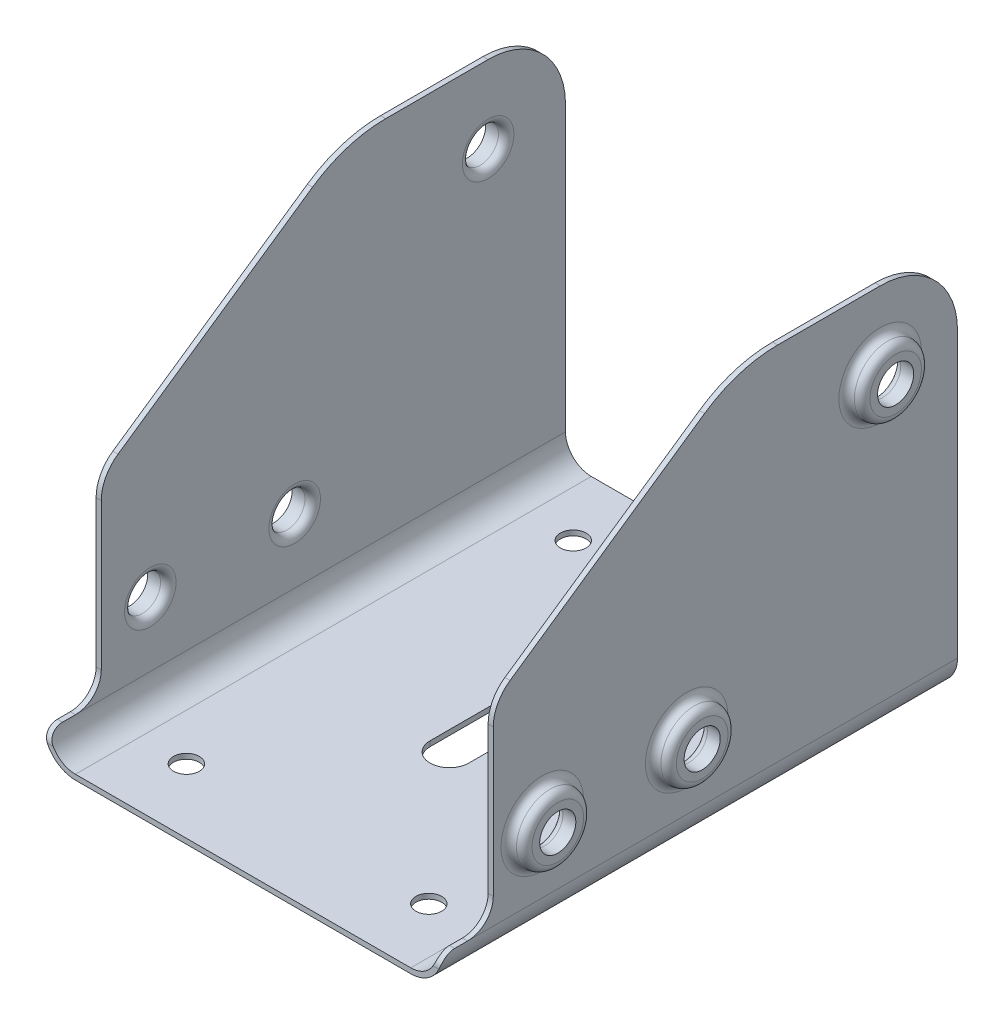
from build123d import *

# Parameters (mm, degrees)
SKETCH1_W                      = 150
SKETCH1_H                      = 200
BASE_FLANGE1_DEPTH             = 2
EDGE_FLANGE1_STRIP_W           = 28
EDGE_FLANGE1_STRIP_H           = 2
EDGE_FLANGE1_STRIP_CUT_DEPTH   = 200
EDGE_FLANGE1_STRIP_2_W         = 28
EDGE_FLANGE1_STRIP_2_H         = 2
EDGE_FLANGE1_STRIP_CUT_2_DEPTH = 200
EDGE_FLANGE1_DEPTH             = 200
EDGE_FLANGE1_BEND_DEPTH        = 200
SKETCH15_OUTSIDE_W             = 260.93
SKETCH15_OUTSIDE_H             = 212.93
SKETCH15_OUTSIDE_R             = 7
CUT_EXTRUDE1_DEPTH             = 238.099135384
SKETCH16_R                     = 5
CUT_EXTRUDE2_DEPTH             = 197.033160551
BOSS_EXTRUDE1_START            = 6
SKETCH17_R                     = 13
SKETCH17_R_2                   = 7
BOSS_EXTRUDE1_DEPTH            = 6
FILLET1_R                      = 3


# Sheet-metal steps are written as plain solids
with BuildPart() as part:
    # Sketch1 → Base-Flange1 (new body)
    with BuildSketch(Plane(origin=(0, 0, 0), x_dir=(1, 0, 0), z_dir=(0, 1, 0))):
        Rectangle(SKETCH1_W, SKETCH1_H)
    extrude(amount=-BASE_FLANGE1_DEPTH)

    # Edge-Flange1 strip (across the edge) → Edge-Flange1 strip cut (cut)
    with BuildSketch(Plane(origin=(75, 0, 100), x_dir=(-1, 0, 0), z_dir=(0, 0, -1))):
        with Locations((-4, -1)):
            Rectangle(EDGE_FLANGE1_STRIP_W, EDGE_FLANGE1_STRIP_H)
    extrude(amount=EDGE_FLANGE1_STRIP_CUT_DEPTH, mode=Mode.SUBTRACT)

    # Edge-Flange1 strip 2 (across the edge) → Edge-Flange1 strip cut 2 (cut)
    with BuildSketch(Plane(origin=(-75, 0, -100), x_dir=(1, 0, 0), z_dir=(0, 0, 1))):
        with Locations((-4, -1)):
            Rectangle(EDGE_FLANGE1_STRIP_2_W, EDGE_FLANGE1_STRIP_2_H)
    extrude(amount=EDGE_FLANGE1_STRIP_CUT_2_DEPTH, mode=Mode.SUBTRACT)

    # Edge-Flange1 section (across the edge) → Edge-Flange1 (add)
    with BuildSketch(Plane(origin=(75, 0, 100), x_dir=(-1, 0, 0), z_dir=(0, 0, -1))):
        with BuildLine():
            Line((-2, 10), (-2, 150))
            Line((-2, 150), (0, 150))
            Line((0, 150), (0, 10))
            ThreePointArc((0, 10), (2.928932188, 2.928932188), (10, 0))
            Line((10, 0), (10, -2))
            ThreePointArc((10, -2), (1.514718626, 1.514718626), (-2, 10))
        make_face()
    extrude(amount=EDGE_FLANGE1_DEPTH)

    # Edge-Flange1 section 2 (across the edge) → Edge-Flange1 bend (add)
    with BuildSketch(Plane(origin=(-75, 0, -100), x_dir=(1, 0, 0), z_dir=(0, 0, 1))):
        with BuildLine():
            Line((-2, 10), (-2, 150))
            Line((-2, 150), (0, 150))
            Line((0, 150), (0, 10))
            ThreePointArc((0, 10), (2.928932188, 2.928932188), (10, 0))
            Line((10, 0), (10, -2))
            ThreePointArc((10, -2), (1.514718626, 1.514718626), (-2, 10))
        make_face()
    extrude(amount=EDGE_FLANGE1_BEND_DEPTH)

    # Sketch15 outside → Cut-Extrude1 (cut, through all)
    # profile 1 of 4: a face of its own
    with BuildSketch(Plane.ZY.offset(77)):
        with Locations((0, 74)):
            Rectangle(SKETCH15_OUTSIDE_W, SKETCH15_OUTSIDE_H)
        with BuildLine():
            Line((-1.916529607, 141.180744276), (73.507242037, 89.243178795))
            ThreePointArc((73.507242037, 89.243178795), (78.277963521, 83.867184852), (80, 76.888955512))
            Line((80, 76.888955512), (80, 20))
            ThreePointArc((80, 20), (82.928932188, 12.928932188), (90, 10))
            Line((90, 10), (95, 10))
            ThreePointArc((95, 10), (98.535533906, 8.535533906), (100, 5))
            Line((100, 5), (100, -2))
            Line((100, -2), (-100, -2))
            Line((-100, -2), (-100, 99))
            Line((-100, 99), (-100, 120))
            ThreePointArc((-100, 120), (-91.213203436, 141.213203436), (-70, 150))
            Line((-70, 150), (-49, 150))
            Line((-49, 150), (-30.274003064, 150))
            ThreePointArc((-30.274003064, 150), (-15.425387199, 147.744304445), (-1.916529607, 141.180744276))
        make_face(mode=Mode.SUBTRACT)
    # profile 2 of 4: a face of its own
    with BuildSketch(Plane.ZY.offset(77)):
        with Locations(Location((61, 35, 0), (0, 0, 270))):
            Circle(SKETCH15_OUTSIDE_R)
    # profile 3 of 4: a face of its own
    with BuildSketch(Plane.ZY.offset(77)):
        with Locations(Location((-70, 120, 0), (0, 0, 270))):
            Circle(SKETCH15_OUTSIDE_R)
    # profile 4 of 4: a face of its own
    with BuildSketch(Plane.ZY.offset(77)):
        with Locations(Location((5, 35, 0), (0, 0, 270))):
            Circle(SKETCH15_OUTSIDE_R)
    extrude(amount=-CUT_EXTRUDE1_DEPTH, mode=Mode.SUBTRACT)

    # Sketch16 → Cut-Extrude2 (cut, through all)
    with BuildSketch(Plane(origin=(0, 0, 0), x_dir=(1, 0, 0), z_dir=(0, 1, 0))):
        with Locations(Location((-47, 75, 0), (0, 0, 270))):
            Circle(SKETCH16_R)
        with Locations(Location((47, 75, 0), (0, 0, 90))):
            Circle(SKETCH16_R)
        with Locations(Location((47, -75, 0), (0, 0, 270))):
            Circle(SKETCH16_R)
        with Locations(Location((-47, -75, 0), (0, 0, 90))):
            Circle(SKETCH16_R)
        with BuildLine():
            Line((7.5, 20), (7.5, -20))
            ThreePointArc((7.5, -20), (0, -27.5), (-7.5, -20))
            Line((-7.5, -20), (-7.5, 20))
            ThreePointArc((-7.5, 20), (0, 27.5), (7.5, 20))
        make_face()
    extrude(amount=-CUT_EXTRUDE2_DEPTH, mode=Mode.SUBTRACT)

    # Sketch17 → Boss-Extrude1 (add)
    # profile 1 of 3: a face of its own
    with BuildSketch(Plane.ZY.offset(77).offset(BOSS_EXTRUDE1_START)):
        with Locations(Location((5, 35, 0), (0, 0, 90))):
            Circle(SKETCH17_R)
        with Locations(Location((5, 35, 0), (0, 0, 270))):
            Circle(SKETCH17_R_2, mode=Mode.SUBTRACT)
    # profile 2 of 3: a face of its own
    with BuildSketch(Plane.ZY.offset(77).offset(BOSS_EXTRUDE1_START)):
        with Locations(Location((61, 35, 0), (0, 0, 90))):
            Circle(SKETCH17_R)
        with Locations(Location((61, 35, 0), (0, 0, 270))):
            Circle(SKETCH17_R_2, mode=Mode.SUBTRACT)
    # profile 3 of 3: a face of its own
    with BuildSketch(Plane.ZY.offset(77).offset(BOSS_EXTRUDE1_START)):
        with Locations(Location((-70, 120, 0), (0, 0, 90))):
            Circle(SKETCH17_R)
        with Locations(Location((-70, 120, 0), (0, 0, 270))):
            Circle(SKETCH17_R_2, mode=Mode.SUBTRACT)
    boss_extrude1 = extrude(amount=-BOSS_EXTRUDE1_DEPTH)

    # Mirror1: Boss-Extrude1 across plane
    add(boss_extrude1.mirror(Plane(origin=(0, 0, 0), x_dir=(0, 0, 1), z_dir=(1, 0, 0))))

    # Fillet1
    fillet1_edges = [part.edges().sort_by_distance(p)[0] for p in [
        (-75, 127, -70),
        (75, 127, -70),
        (-75, 42, 5),
        (75, 42, 5),
        (-75, 42, 61),
        (75, 42, 61),
        (-77, 22, 5),
        (-77, 22, 61),
        (-77, 107, -70),
        (-83, 107, -70),
        (-83, 22, 61),
        (-83, 22, 5),
        (83, 107, -70),
        (77, 107, -70),
        (83, 22, 61),
        (77, 22, 61),
        (83, 22, 5),
        (77, 22, 5),
    ]]
    fillet(fillet1_edges, radius=FILLET1_R - 0.0001)  # a hair under: the kernel refuses the full size


solid = part.part
